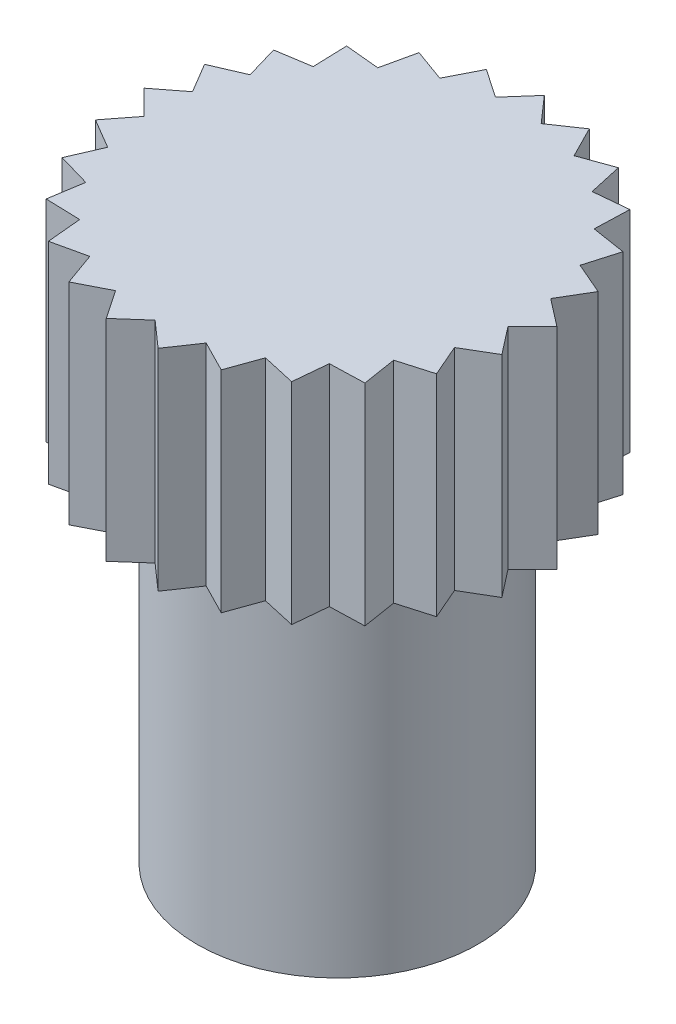
from build123d import *

# Parameters (mm, degrees)
SKETCH1_R           = 2
BOSS_EXTRUDE1_DEPTH = 5.01
BOSS_EXTRUDE2_DEPTH = 3


with BuildPart() as part:
    # Sketch1 → Boss-Extrude1 (new body)
    with BuildSketch(Plane(origin=(0, 0, 0), x_dir=(1, 0, 0), z_dir=(0, 1, 0))):
        Circle(SKETCH1_R)
    extrude(amount=BOSS_EXTRUDE1_DEPTH)

    # Sketch4 → Boss-Extrude2 (add)
    with BuildSketch(Plane(origin=(0, 5.01, 0), x_dir=(1, 0, 0), z_dir=(0, 1, 0))):
        Polygon((0.325866407, 2.579498223), (0, 2.95), (-0.325866407, 2.579498223), (-0.733635167, 2.857320325), (-0.957123837, 2.417418863), (-1.421173339, 2.585104706), (-1.528241656, 2.103444185), (-2.019413962, 2.150457451), (-2.003334431, 1.657302373), (-2.49076738, 1.580689045), (-2.352550336, 1.107026158), (-2.805616723, 0.911600133), (-2.553946852, 0.487191418), (-2.944178849, 0.185232033), (-2.594869494, -0.163255351), (-2.89774739, -0.552774878), (-2.472746942, -0.803444185), (-2.669239805, -1.25604891), (-2.195252606, -1.393149667), (-2.273014066, -1.88040077), (-1.779822475, -1.895318431), (-1.733966494, -2.386600133), (-1.252559553, -2.278397368), (-1.08596743, -2.742840633), (-0.646593707, -2.518316219), (-0.369733039, -2.926738369), (0, -2.6), (0.369733039, -2.926738369), (0.646593707, -2.518316219), (1.08596743, -2.742840633), (1.252559553, -2.278397368), (1.733966494, -2.386600133), (1.779822475, -1.895318431), (2.273014066, -1.88040077), (2.195252606, -1.393149667), (2.669239805, -1.25604891), (2.472746942, -0.803444185), (2.89774739, -0.552774878), (2.594869494, -0.163255351), (2.944178849, 0.185232033), (2.553946852, 0.487191418), (2.805616723, 0.911600133), (2.352550336, 1.107026158), (2.49076738, 1.580689045), (2.003334431, 1.657302373), (2.019413962, 2.150457451), (1.528241656, 2.103444185), (1.421173339, 2.585104706), (0.957123837, 2.417418863), (0.733635167, 2.857320325), align=None)
    extrude(amount=BOSS_EXTRUDE2_DEPTH)


solid = part.part
